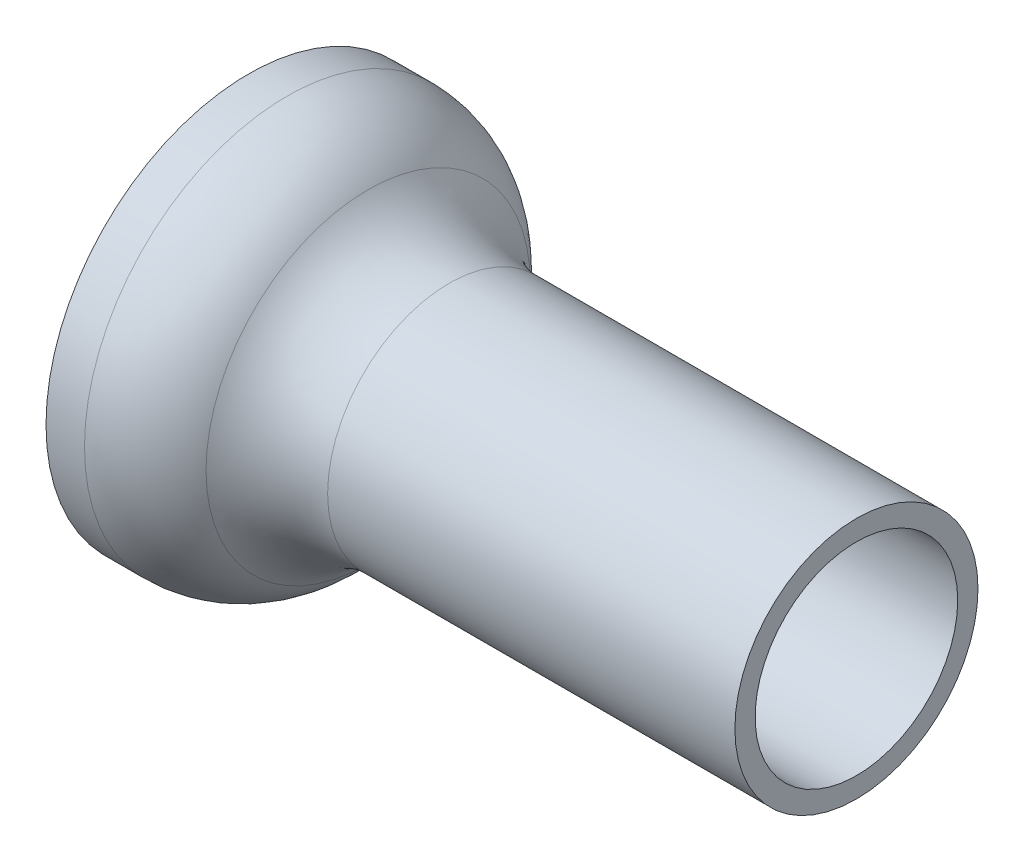
from build123d import *

# Parameters (mm, degrees)
SKETCH1_R           = 3
SKETCH1_R_2         = 2.5000000000000004
BOSS_EXTRUDE1_DEPTH = 15
SKETCH2_R           = 5
SKETCH2_R_2         = 3.0000000000000004
BOSS_EXTRUDE2_DEPTH = 2.5
FILLET1_R           = 2.5
FILLET2_R           = 2.5


with BuildPart() as part:
    # Sketch1 → Boss-Extrude1 (new body)
    with BuildSketch(Plane(origin=(0, 0, 0), x_dir=(0, 0, -1), z_dir=(1, 0, 0))):
        Circle(SKETCH1_R)
        Circle(SKETCH1_R_2, mode=Mode.SUBTRACT)
    extrude(amount=BOSS_EXTRUDE1_DEPTH)

    # Sketch2 → Boss-Extrude2 (add)
    with BuildSketch(Plane(origin=(0, 0, 0), x_dir=(0, 0, -1), z_dir=(1, 0, 0))):
        Circle(SKETCH2_R)
        Circle(SKETCH2_R_2, mode=Mode.SUBTRACT)
    extrude(amount=BOSS_EXTRUDE2_DEPTH)

    # Fillet1
    # the kernel refuses this fillet: 2.5 mm, written as the material it adds along each edge
    with BuildSketch(Plane(origin=(2.5, 0, 0), x_dir=(0, 0, -1), z_dir=(0, -1, 0))) as fillet1_piece_1:
        with BuildLine():
            CenterArc((5.5, 2.449489742786441), FILLET1_R, 180, 78.4630409671995)
            Line((5.0000000000006395, 3.13216e-12), (4.990000000000652, -0.04898979485253419))
            ThreePointArc((4.990000000000652, -0.04898979485253419), (4.00000000000032, -0.04999999999999982), (3.0000000000000004, -0.04999999999999982))
            Line((3.0000000000000004, -0.04999999999999982), (2.9500000000000006, 0))
            Line((2.9500000000000006, 0), (2.95, 2.449489742786441))
            Line((2.95, 2.449489742786441), (3, 2.449489742786441))
        make_face()
    revolve(axis=Axis((2.5, 0, 0), (1, 0, 0)))

    # Fillet2
    fillet2_edges = [part.edges().sort_by_distance(p)[0] for p in [
        (2.5, 6.1e-16, 5),
    ]]
    fillet(fillet2_edges, radius=FILLET2_R)


solid = part.part
